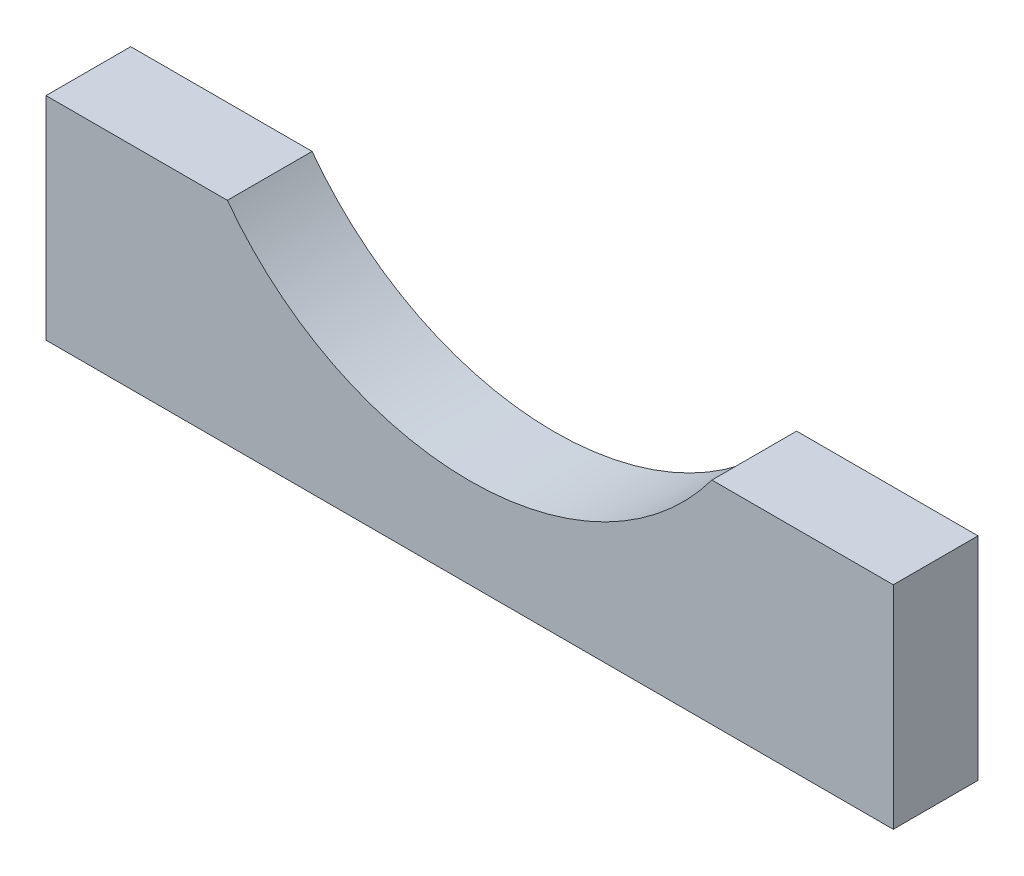
from build123d import *

# Parameters (mm, degrees)
SKETCH2_W           = 40
SKETCH2_H           = 10
BOSS_EXTRUDE2_DEPTH = 4
SKETCH4_R           = 14.25
CUT_EXTRUDE1_DEPTH  = 42.424630354


with BuildPart() as part:
    # Sketch2 → Boss-Extrude2 (new body)
    with BuildSketch(Plane.XY):
        with Locations((20, 5)):
            Rectangle(SKETCH2_W, SKETCH2_H)
    extrude(amount=BOSS_EXTRUDE2_DEPTH)

    # Sketch4 → Cut-Extrude1 (cut, through all)
    with BuildSketch(Plane.XY.offset(4)):
        with Locations((20, 18.5)):
            Circle(SKETCH4_R)
    extrude(amount=-CUT_EXTRUDE1_DEPTH, mode=Mode.SUBTRACT)


solid = part.part
